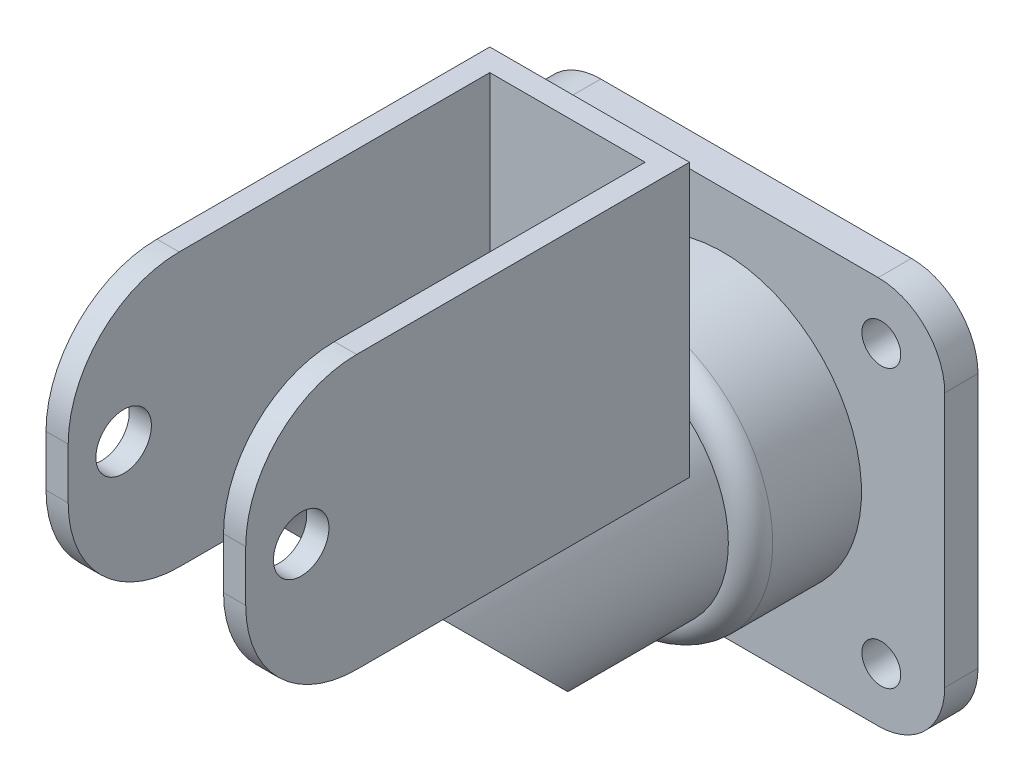
from build123d import *

# Parameters (mm, degrees)
SKETCH_1_R               = 1.75
EXTRUDE_1_DEPTH          = 3
SKETCH_2_R               = 12.5
EXTRUDE_2_DEPTH          = 10
FILLET_1_R               = 2
SKETCH_5_R               = 10.5
EXTRUDE_4_DEPTH          = 30
SKETCH_7_W               = 18
SKETCH_7_H               = 40
EXTRUDE_5_DEPTH          = 28
CUT_EXTRUDE_1_DEPTH      = 70.036222376
CUT_EXTRUDE_1_DEPTH_BACK = 70.036222376
SHELL_START              = 17
SHELL_1_DEPTH            = 38
SHELL_START_2            = 2
SHELL_1_2_OUTLINE_R      = 8.5
SHELL_1_2_DEPTH          = 15
FILLET_2_R               = 10
SKETCH_9_R               = 2.5
CUT_EXTRUDE_2_DEPTH      = 70.036222376


# Read off the part's stored shape, not the designer's step: 抽壳1
with BuildPart() as part:
    # 草图1 → 凸台-拉伸1 (new body)
    with BuildSketch(Plane.XY):
        with BuildLine():
            Line((-14, -17.5), (14, -17.5))
            ThreePointArc((14, -17.5), (18.242640687, -15.742640687), (20, -11.5))
            Line((20, -11.5), (20, 11.5))
            ThreePointArc((20, 11.5), (18.242640687, 15.742640687), (14, 17.5))
            Line((14, 17.5), (-14, 17.5))
            ThreePointArc((-14, 17.5), (-18.242640687, 15.742640687), (-20, 11.5))
            Line((-20, 11.5), (-20, -11.5))
            ThreePointArc((-20, -11.5), (-18.242640687, -15.742640687), (-14, -17.5))
        make_face()
        with Locations((-14.285714286, 12.5)):
            Circle(SKETCH_1_R, mode=Mode.SUBTRACT)
        with Locations((-14.285714286, -12.5)):
            Circle(SKETCH_1_R, mode=Mode.SUBTRACT)
        with Locations((14.285714286, -12.5)):
            Circle(SKETCH_1_R, mode=Mode.SUBTRACT)
        with Locations((14.285714286, 12.5)):
            Circle(SKETCH_1_R, mode=Mode.SUBTRACT)
    extrude(amount=EXTRUDE_1_DEPTH)

    # 草图2 → 凸台-拉伸2 (add)
    with BuildSketch(Plane.XY.offset(3)):
        with Locations(Location((0, 0, 0), (0, 0, 180))):
            Circle(SKETCH_2_R)
    extrude(amount=EXTRUDE_2_DEPTH)

    # 圆角1
    fillet_1_edges = [part.edges().sort_by_distance(p)[0] for p in [
        (12.5, 0, 13),
    ]]
    fillet(fillet_1_edges, radius=FILLET_1_R)

    # 草图5 → 凸台-拉伸4 (add)
    with BuildSketch(Plane.XY.offset(13)):
        Circle(SKETCH_5_R)
    extrude(amount=EXTRUDE_4_DEPTH)

    # Surface Cut 2
    split(bisect_by=Plane(origin=(0, -15.906854249, 15.906854249), x_dir=(1, 0, 0), z_dir=(0, -0.7071067811865488, 0.7071067811865464)), keep=Keep.BOTTOM)

    # 草图7 → 凸台-拉伸5 (add)
    with BuildSketch(Plane(origin=(0, 30, 0), x_dir=(1, 0, 0), z_dir=(0, 1, 0))):
        with Locations((0, -35)):
            Rectangle(SKETCH_7_W, SKETCH_7_H)
    extrude(amount=-EXTRUDE_5_DEPTH)

    # 草图8 → 切除-拉伸1 (cut, two sides: drawn at the far end of the back side and taken through both)
    with BuildSketch(Plane(origin=(9, 0, 0), x_dir=(0, 0, -1), z_dir=(1, 0, 0)).offset(-CUT_EXTRUDE_1_DEPTH_BACK)):
        Polygon((-37.222035412, 5.408326913), (-55, 5.408326913), (-55, 2), (-33.813708499, 2), align=None)
    extrude(amount=CUT_EXTRUDE_1_DEPTH + CUT_EXTRUDE_1_DEPTH_BACK, mode=Mode.SUBTRACT)

    # 抽壳1 outline → 抽壳1 (cut)
    with BuildSketch(Plane.XY.offset(SHELL_START)):
        with BuildLine():
            Line((7, 30), (-7, 30))
            Line((-7, 30), (-7, 4.82182538))
            ThreePointArc((-7, 4.82182538), (0, -8.5), (7, 4.82182538))
            Line((7, 4.82182538), (7, 30))
        make_face()
    extrude(amount=SHELL_1_DEPTH, mode=Mode.SUBTRACT)

    # Shell 1 2 outline → Shell 1 2 (cut)
    with BuildSketch(Plane.XY.offset(SHELL_START_2)):
        Circle(SHELL_1_2_OUTLINE_R)
    extrude(amount=SHELL_1_2_DEPTH, mode=Mode.SUBTRACT)

    # 圆角2
    fillet_2_edges = [part.edges().sort_by_distance(p)[0] for p in [
        (8, 5.408326913, 55),
        (8, 30, 55),
        (-8, 30, 55),
        (-8, 5.408326913, 55),
    ]]
    fillet(fillet_2_edges, radius=FILLET_2_R)

    # 草图9 → 切除-拉伸2 (cut, through all)
    with BuildSketch(Plane(origin=(9, 0, 0), x_dir=(0, 0, -1), z_dir=(1, 0, 0))):
        with Locations((-50, 17.704163457)):
            Circle(SKETCH_9_R)
    extrude(amount=-CUT_EXTRUDE_2_DEPTH, mode=Mode.SUBTRACT)


solid = part.part
